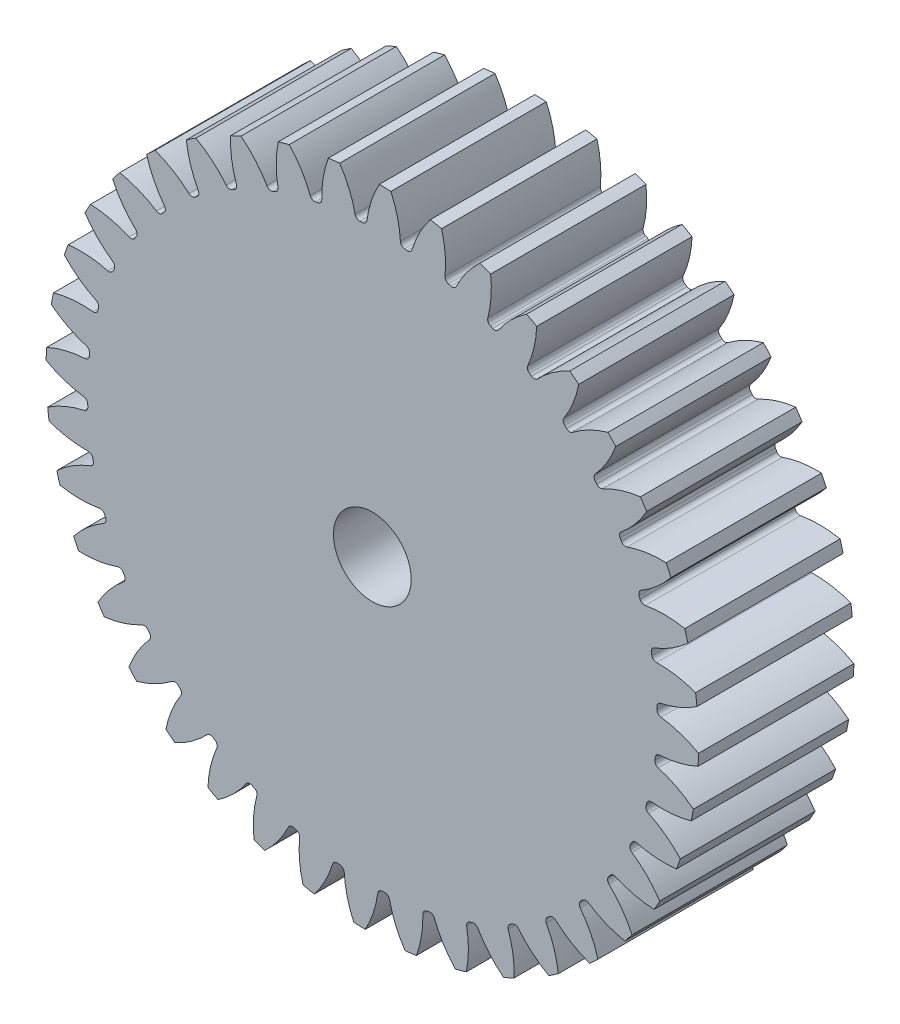
from build123d import *

# Parameters (mm, degrees)
SALIENTE_EXTRUIR1_DEPTH = 10
REDONDEO1_R             = 0.3
MATRIZC1_COUNT          = 40
REDONDEO1_OF_MATRIZC1_R = 0.3
CROQUIS3_R              = 2.5
CORTAR_EXTRUIR1_DEPTH   = 32.330262761


with BuildPart() as part:
    # Croquis2 → Saliente-Extruir1 (new body)
    with BuildSketch(Plane.XY):
        with BuildLine():
            ThreePointArc((-0.38008316, 18.326058954), (-0.7194525, -18.315875303), (1.816399154, 18.239780539))
            ThreePointArc((1.816399154, 18.239780539), (1.645473715, 19.635138521), (1.192918165, 20.96609039))
            ThreePointArc((1.192918165, 20.96609039), (0.82425, 20.983817859), (0.455327213, 20.995063161))
            ThreePointArc((0.455327213, 20.995063161), (-0.100233168, 19.703710356), (-0.38008316, 18.326058954))
        make_face()
    saliente_extruir1 = extrude(amount=SALIENTE_EXTRUIR1_DEPTH)

    # Redondeo1
    redondeo1_edges = [part.edges().sort_by_distance(p)[0] for p in [
        (-0.38008316, 18.326058954, 5),
        (1.816399154, 18.239780539, 5),
    ]]
    fillet(redondeo1_edges, radius=REDONDEO1_R)

    # MatrizC1: Saliente-Extruir1 ×40 about axis
    matrizc1_axis = Axis((0, 0, 10), (0, 0, 1))
    for i in range(1, MATRIZC1_COUNT):
        add(saliente_extruir1.rotate(matrizc1_axis, i * 360 / MATRIZC1_COUNT))

    # Redondeo1 of MatrizC1
    redondeo1_of_matrizc1_edges = [part.edges().sort_by_distance(p)[0] for p in [
        (-3.242230934, 18.040976652, 5),
        (-1.059294045, 18.299366003, 5),
        (-6.024544223, 17.311665631, 5),
        (-3.908903909, 17.908360345, 5),
        (-8.658513238, 16.156083947, 5),
        (-6.662263586, 17.07639142, 5),
        (-11.079280921, 14.602685858, 5),
        (-9.251576222, 15.823945065, 5),
        (-13.227239939, 12.689721179, 5),
        (-11.613084348, 14.181860665, 5),
        (-15.04950041, 10.46429345, 5),
        (-13.688639795, 12.19057179, 5),
        (-16.501192234, 7.981200088, 5),
        (-15.427135501, 9.899110578, 5),
        (-17.546569942, 5.301583091, 5),
        (-16.785763931, 7.363900411, 5),
        (-18.159892864, 2.491423524, 5),
        (-17.731071144, 4.647366577, 5),
        (-18.326058954, -0.38008316, 5),
        (-18.239780539, 1.816399154, 5),
        (-18.040976652, -3.242230934, 5),
        (-18.299366003, -1.059294045, 5),
        (-17.311665631, -6.024544223, 5),
        (-17.908360345, -3.908903909, 5),
        (-16.156083947, -8.658513238, 5),
        (-17.07639142, -6.662263586, 5),
        (-14.602685858, -11.079280921, 5),
        (-15.823945065, -9.251576222, 5),
        (-12.689721179, -13.227239939, 5),
        (-14.181860665, -11.613084348, 5),
        (-10.46429345, -15.04950041, 5),
        (-12.19057179, -13.688639795, 5),
        (-7.981200088, -16.501192234, 5),
        (-9.899110578, -15.427135501, 5),
        (-5.301583091, -17.546569942, 5),
        (-7.363900411, -16.785763931, 5),
        (-2.491423524, -18.159892864, 5),
        (-4.647366577, -17.731071144, 5),
        (0.38008316, -18.326058954, 5),
        (-1.816399154, -18.239780539, 5),
        (3.242230934, -18.040976652, 5),
        (1.059294045, -18.299366003, 5),
        (6.024544223, -17.311665631, 5),
        (3.908903909, -17.908360345, 5),
        (8.658513238, -16.156083947, 5),
        (6.662263586, -17.07639142, 5),
        (11.079280921, -14.602685858, 5),
        (9.251576222, -15.823945065, 5),
        (13.227239939, -12.689721179, 5),
        (11.613084348, -14.181860665, 5),
        (15.04950041, -10.46429345, 5),
        (13.688639795, -12.19057179, 5),
        (16.501192234, -7.981200088, 5),
        (15.427135501, -9.899110578, 5),
        (17.546569942, -5.301583091, 5),
        (16.785763931, -7.363900411, 5),
        (18.159892864, -2.491423524, 5),
        (17.731071144, -4.647366577, 5),
        (18.326058954, 0.38008316, 5),
        (18.239780539, -1.816399154, 5),
        (18.040976652, 3.242230934, 5),
        (18.299366003, 1.059294045, 5),
        (17.311665631, 6.024544223, 5),
        (17.908360345, 3.908903909, 5),
        (16.156083947, 8.658513238, 5),
        (17.07639142, 6.662263586, 5),
        (14.602685858, 11.079280921, 5),
        (15.823945065, 9.251576222, 5),
        (12.689721179, 13.227239939, 5),
        (14.181860665, 11.613084348, 5),
        (10.46429345, 15.04950041, 5),
        (12.19057179, 13.688639795, 5),
        (7.981200088, 16.501192234, 5),
        (9.899110578, 15.427135501, 5),
        (5.301583091, 17.546569942, 5),
        (7.363900411, 16.785763931, 5),
        (2.491423524, 18.159892864, 5),
        (4.647366577, 17.731071144, 5),
    ]]
    fillet(redondeo1_of_matrizc1_edges, radius=REDONDEO1_OF_MATRIZC1_R)

    # Croquis3 → Cortar-Extruir1 (cut, through all)
    with BuildSketch(Plane.XY.offset(10)):
        Circle(CROQUIS3_R)
    extrude(amount=-CORTAR_EXTRUIR1_DEPTH, mode=Mode.SUBTRACT)


solid = part.part
